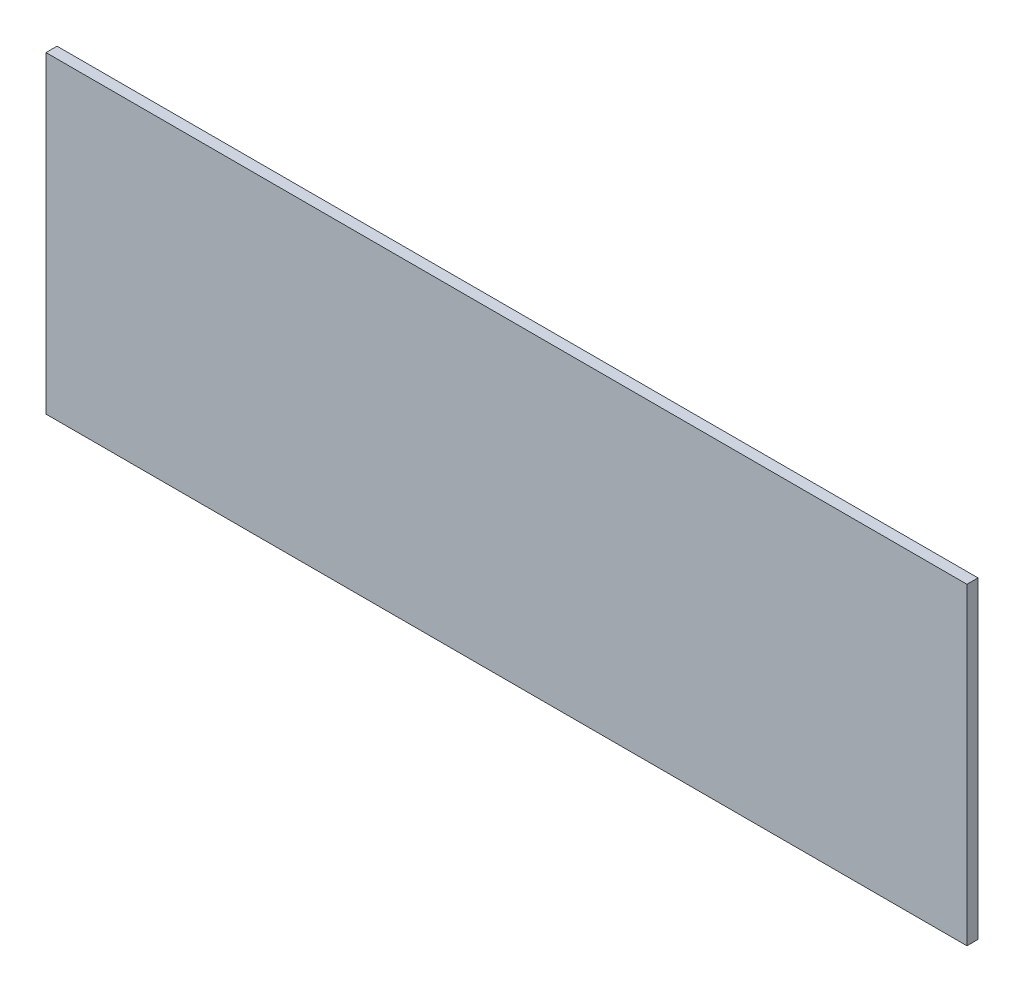
from build123d import *

# Parameters (mm, degrees)
SKETCH1_W           = 250
SKETCH1_H           = 85
BOSS_EXTRUDE1_DEPTH = 3


with BuildPart() as part:
    # Sketch1 → Boss-Extrude1 (new body)
    with BuildSketch(Plane.XY):
        Rectangle(SKETCH1_W, SKETCH1_H)
    extrude(amount=BOSS_EXTRUDE1_DEPTH)


solid = part.part
